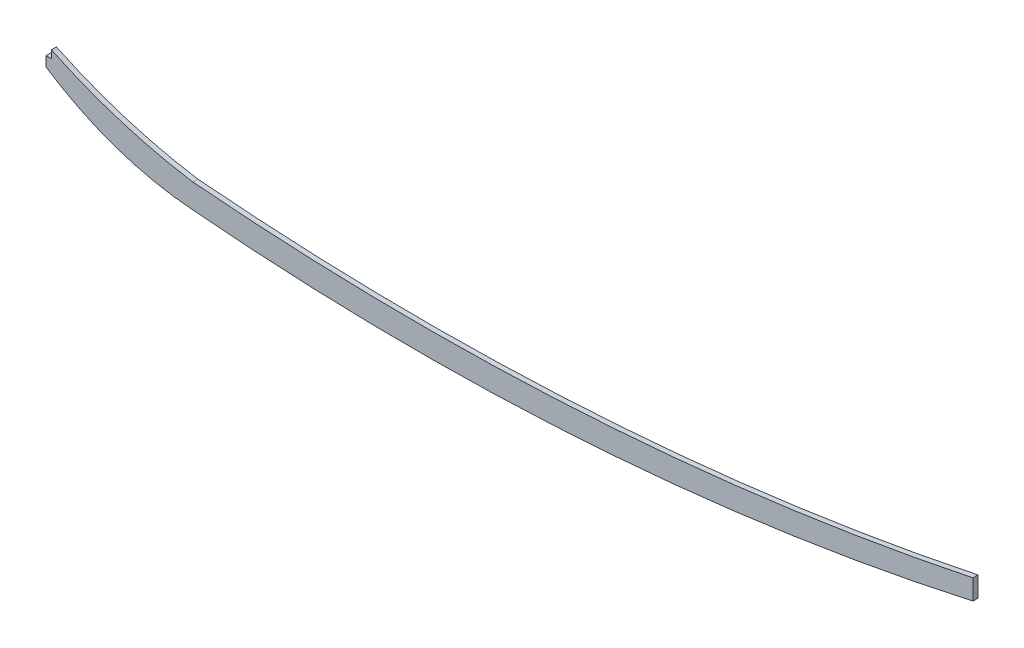
from build123d import *

# Parameters (mm, degrees)
BOSS_EXTRUDE1_DEPTH = 1.5875
SKETCH2_W           = 3.3782
SKETCH2_H           = 6.477
CUT_EXTRUDE1_DEPTH  = 600.054534432


with BuildPart() as part:
    # Sketch1 → Boss-Extrude1 (new, symmetric)
    with BuildSketch(Plane.XY):
        with BuildLine():
            Line((0, -84.863004684), (0, -97.563004684))
            ThreePointArc((0, -97.563004684), (44.158404147, -119.360611557), (92.3925, -129.288970912))
            ThreePointArc((92.3925, -129.288970912), (339.198389145, -132.023125314), (583.522463964, -97.003573898))
            Line((583.522463964, -97.003573898), (583.522463964, -84.303573898))
            ThreePointArc((583.522463964, -84.303573898), (339.042339878, -117.088496575), (92.3925, -114.048970912))
            ThreePointArc((92.3925, -114.048970912), (45.091480007, -102.953300884), (0, -84.863004684))
        make_face()
    extrude(amount=BOSS_EXTRUDE1_DEPTH, both=True)

    # Sketch2 → Cut-Extrude1 (cut, through all)
    with BuildSketch(Plane.XY.offset(1.5875)):
        with Locations((1.6891, -88.101504684)):
            Rectangle(SKETCH2_W, SKETCH2_H)
    extrude(amount=-CUT_EXTRUDE1_DEPTH, mode=Mode.SUBTRACT)


solid = part.part
